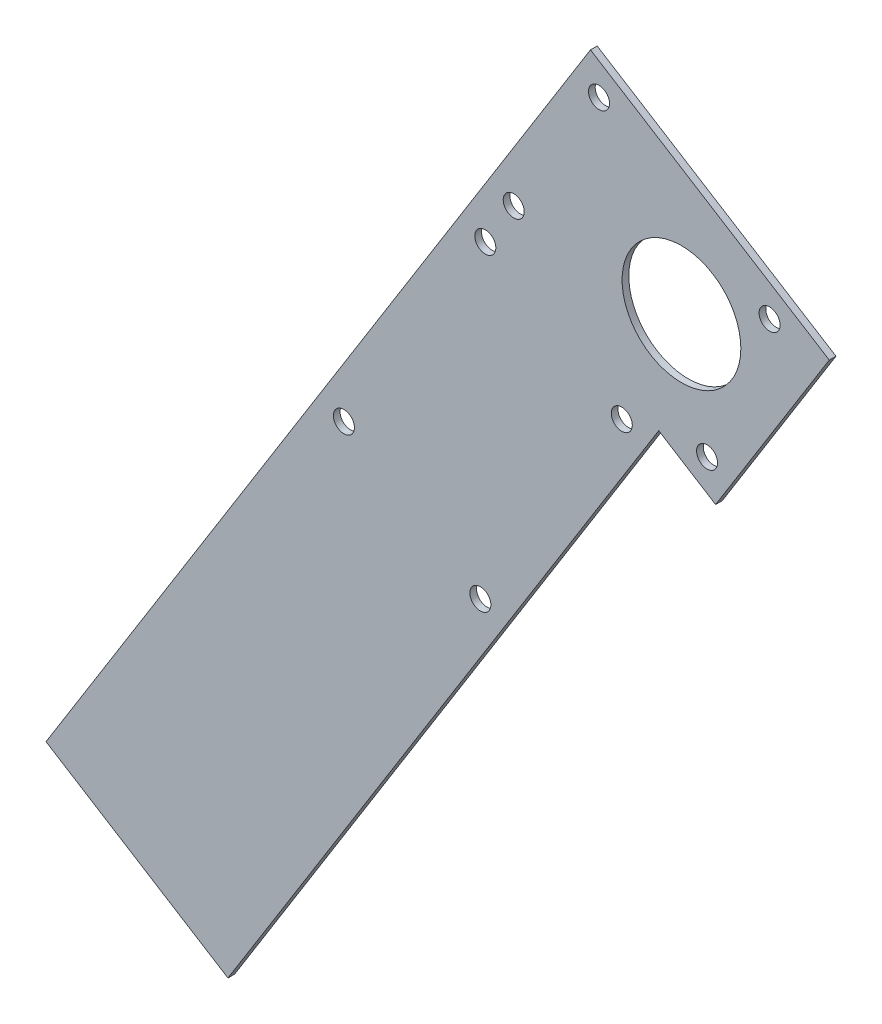
from build123d import *

# Parameters (mm, degrees)
BOSS_EXTRUDE1_DEPTH    = 1.5875
F_10_CLEARANCE_HOLE1_D = 4.9784
SKETCH5_R              = 14.057169334
CUT_EXTRUDE1_DEPTH     = 2.54


with BuildPart() as part:
    # Sketch2 → Boss-Extrude1 (new body)
    with BuildSketch(Plane(origin=(0, 0, 375.412), x_dir=(-1, 0, 0), z_dir=(0, 0, -1))):
        Polygon((-54.523488728, -26.582274205), (-27.603590105, -69.663117489), (-14.140826579, -61.25064917), (87.851311222, -224.472188982), (130.932154506, -197.552290359), (2.020118083, 8.750092738), align=None)
    extrude(amount=BOSS_EXTRUDE1_DEPTH)

    # #10 Clearance Hole1 (through all)
    with Locations(Plane(origin=(0, 0, 373.8245), x_dir=(-1, 0, 0), z_dir=(0, 0, -1))):
        with Locations((-5.39073384, -63.270767252), (-25.583472022, -60.913024751), (-40.388290579, -25.237404959), (0, 0), (20.189923968, -32.310632464), (26.919898623, -43.080843285), (60.403864787, -96.666390506), (28.093232323, -116.856314473)):
            Hole(F_10_CLEARANCE_HOLE1_D / 2)

    # Sketch5 → Cut-Extrude1 (cut)
    with BuildSketch(Plane.XY.offset(375.412)):
        with Locations((19.523118205, -34.662746805)):
            Circle(SKETCH5_R)
    extrude(amount=-CUT_EXTRUDE1_DEPTH, mode=Mode.SUBTRACT)


solid = part.part
